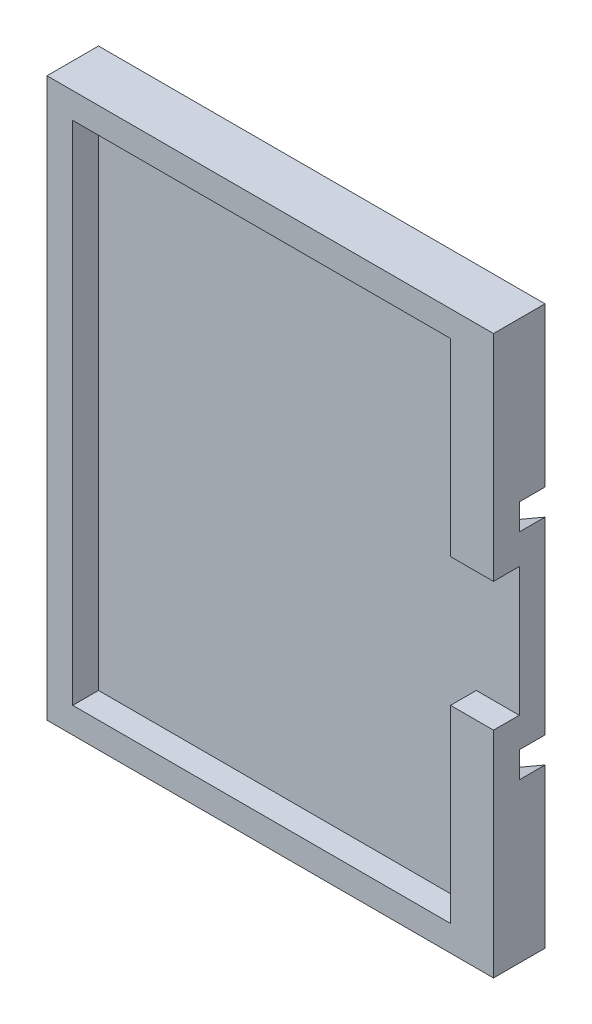
from build123d import *

# Parameters (mm, degrees)
BOSS_EXTRUDE1_DEPTH = 6
BOSS_EXTRUDE2_DEPTH = 6


with BuildPart() as part:
    # Sketch1 → Boss-Extrude1 (new body)
    with BuildSketch(Plane.XY):
        Polygon((-40, 65), (-40, -65), (64, -65), (64, -28.027844815), (55.873, -32.719970453), (55.873, -17.280029547), (64, -21.972155185), (64, 21.972155185), (55.873, 17.280029547), (55.873, 32.719970453), (64, 28.027844815), (64, 65), align=None)
    extrude(amount=BOSS_EXTRUDE1_DEPTH)

    # Sketch2 → Boss-Extrude2 (add)
    with BuildSketch(Plane.XY.offset(6)):
        Polygon((-40, 65), (64, 65), (64, 15), (54, 15), (54, 59), (-34, 59), (-34, -59), (54, -59), (54, -15), (64, -15), (64, -65), (-40, -65), align=None)
    extrude(amount=BOSS_EXTRUDE2_DEPTH)


solid = part.part
